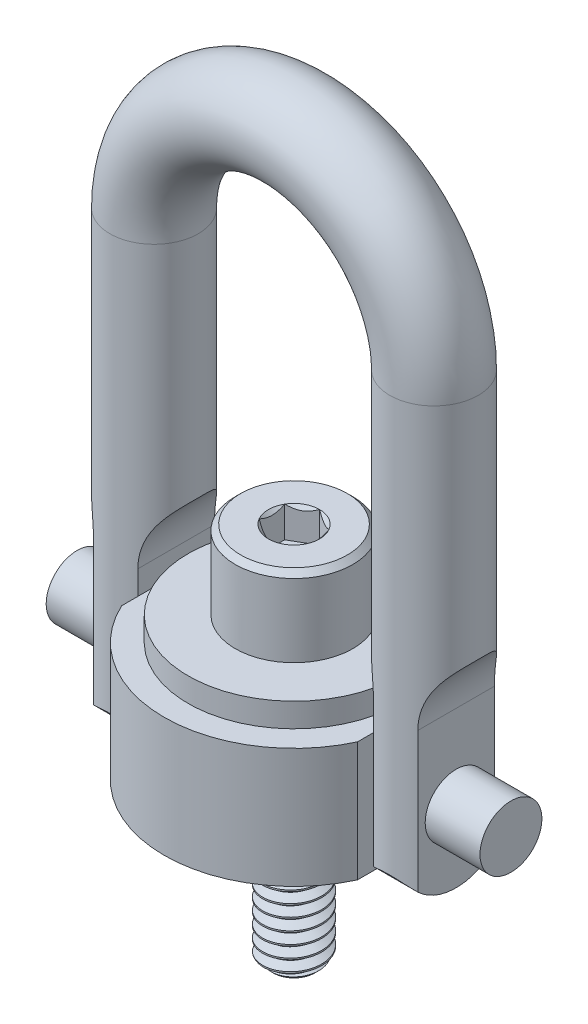
from build123d import *

# Parameters (mm, degrees)
SKETCH5_R               = 4.7625
CUT_EXTRUDE3_START      = -4.124446086
CUT_EXTRUDE3_DEPTH      = 8.248892072
CUT_EXTRUDE5_START      = 2.576285714
CUT_EXTRUDE5_DEPTH      = 12.881428572
CUT_EXTRUDE4_DEPTH      = 73.451442211
CUT_EXTRUDE4_DEPTH_BACK = 73.451442211
SKETCH8_R               = 2.524125
CHAMFER2_SIZE           = 0.9525
CUT_SWEEP1_PITCH        = 1.27
CUT_EXTRUDE1_DEPTH      = 3.33375
CHAMFER1_SIZE           = 0.591185
SKETCH15_R              = 3.175
CUT_EXTRUDE6_DEPTH      = 58.136973904


# Read off the part's stored shape, not the designer's step: Cut-Extrude3, Cut-Extrude5
with BuildPart() as part:
    # Sketch1 → Revolve1 (revolve)
    with BuildSketch(Plane.XY, mode=Mode.PRIVATE) as revolve1_sk:
        Polygon((-11.411857143, 18.034), (-11.411857143, 15.457714286), (-13.988142857, 15.457714286), (-13.988142857, 2.576285714), (-8.835571429, 2.576285714), (-8.835571429, 0), (-3.175, 0), (-3.175, 18.034), align=None)
    revolve(revolve1_sk.sketch.rotate(Axis((0, 0, 0), (0, 1, 0)), 270), axis=Axis((0, 0, 0), (0, 1, 0)))

    # Cut-Extrude5 outline → Cut-Extrude5 (cut)
    with BuildSketch(Plane(origin=(0, 0, 0), x_dir=(1, 0, 0), z_dir=(0, 1, 0)).offset(CUT_EXTRUDE5_START)):
        with BuildLine():
            Line((12.7, 5.863287524), (12.7, -5.863287524))
            ThreePointArc((12.7, -5.863287524), (13.988142857, 0), (12.7, 5.863287524))
        make_face()
        with BuildLine():
            ThreePointArc((-12.7, 5.863287524), (-13.988142857, 0), (-12.7, -5.863287524))
            Line((-12.7, -5.863287524), (-12.7, 5.863287524))
        make_face()
    extrude(amount=CUT_EXTRUDE5_DEPTH, mode=Mode.SUBTRACT)

    # Sketch9 → Revolve3 (revolve)
    with BuildSketch(Plane.XY, mode=Mode.PRIVATE) as revolve3_sk:
        Polygon((-17.4625, 11.541125), (17.4625, 11.541125), (17.4625, 12.35075), (23.368, 12.35075), (23.368, 9.017), (-23.368, 9.017), (-23.368, 12.35075), (-17.4625, 12.35075), align=None)
    revolve(revolve3_sk.sketch.rotate(Axis((-23.368, 9.017, 0), (1, 0, 0)), 90), axis=Axis((-23.368, 9.017, 0), (1, 0, 0)))

    # Sketch15 → Cut-Extrude6 (cut, through all)
    with BuildSketch(Plane(origin=(0, 18.034, 0), x_dir=(1, 0, 0), z_dir=(0, 1, 0))):
        Circle(SKETCH15_R)
    extrude(amount=-CUT_EXTRUDE6_DEPTH, mode=Mode.SUBTRACT)


with BuildPart() as body_2:
    # Sweep1: sweep along a path in Sketch6
    with BuildLine(Plane.XY) as sweep1_path:
        Line((-10.31875, 0), (-10.31875, 48.41875))
        ThreePointArc((-10.31875, 48.41875), (0, 58.7375), (10.31875, 48.41875))
        Line((10.31875, 48.41875), (10.31875, 0))
    # Sketch5 → Sweep1 (sweep)
    with BuildSketch(Plane(origin=(0, 0, 0), x_dir=(1, 0, 0), z_dir=(0, 1, 0))):
        with Locations((-15.08125, 0)):
            Circle(SKETCH5_R)
    sweep(path=sweep1_path.line)

    # Cut-Extrude3 outline → Cut-Extrude3 (cut)
    with BuildSketch(Plane.XY.offset(CUT_EXTRUDE3_START)):
        with BuildLine():
            Line((-17.4625, 0), (-17.4625, 18.034))
            ThreePointArc((-17.4625, 18.034), (-18.081454591, 21.145465211), (-19.844074757, 23.783170784))
            Line((-19.844074757, 23.783170784), (-21, 24.93896544))
            Line((-21, 24.93896544), (-21, 0))
            Line((-21, 0), (-17.4625, 0))
        make_face()
        with BuildLine():
            Line((-12.7, 18.034), (-12.7, 0))
            Line((-12.7, 0), (-9, 0))
            Line((-9, 0), (-9, 25))
            Line((-9, 25), (-9.101458544, 25))
            Line((-9.101458544, 25), (-10.318425243, 23.783170784))
            ThreePointArc((-10.318425243, 23.783170784), (-12.081045409, 21.145465211), (-12.7, 18.034))
        make_face()
    cut_extrude3 = extrude(amount=CUT_EXTRUDE3_DEPTH, mode=Mode.SUBTRACT)

    # Mirror1: Cut-Extrude3 across plane
    add(cut_extrude3.mirror(Plane(origin=(0, 0, 0), x_dir=(0, 0, 1), z_dir=(1, 0, 0))), mode=Mode.SUBTRACT)

    # Sketch8 → Cut-Extrude4 (cut, two sides: drawn at the far end of the back side and taken through both)
    with BuildSketch(Plane(origin=(0, 0, 0), x_dir=(0, 0, -1), z_dir=(1, 0, 0)).offset(-CUT_EXTRUDE4_DEPTH_BACK)):
        with Locations((0, 9.017)):
            Circle(SKETCH8_R)
        with BuildLine():
            Line((4.7625, 3.669392857), (4.7625, 0))
            Line((4.7625, 0), (-4.7625, 0))
            Line((-4.7625, 0), (-4.7625, 3.669392857))
            ThreePointArc((-4.7625, 3.669392857), (0, 1.288142857), (4.7625, 3.669392857))
        make_face()
    extrude(amount=CUT_EXTRUDE4_DEPTH + CUT_EXTRUDE4_DEPTH_BACK, mode=Mode.SUBTRACT)


with BuildPart() as body_3:
    # Sketch2 → Revolve2 (revolve)
    with BuildSketch(Plane.XY):
        Polygon((6.334125, 26.4795), (0, 26.4795), (0, -14.2875), (3.175, -14.2875), (3.175, 18.034), (6.334125, 18.034), align=None)
    revolve(axis=Axis((0, -14.2875, 0), (0, 1, 0)))

    # Chamfer2
    chamfer2_edges = [body_3.edges().sort_by_distance(p)[0] for p in [
        (-3.175, -14.2875, 0),
    ]]
    chamfer(chamfer2_edges, length=CHAMFER2_SIZE)

    # Cut-Sweep1: the profile of Sketch11 profile screwed along a right-hand helix of 24.45 turns, 8 arcs to a turn; built about Z, then put on its axis
    cut_sweep1_z = Axis((0, 0, 0), (0, 0, 1))
    cut_sweep1_corners = [(3.1753, 0, 0.000173205), (3.1753, 0, -1.111423205), (2.350110803, 0, -0.635), (2.350110803, 0, -0.47625)]
    with BuildLine(mode=Mode.PRIVATE) as cut_sweep1_profile:
        Line(cut_sweep1_corners[0], cut_sweep1_corners[1])
        Line(cut_sweep1_corners[1], cut_sweep1_corners[2])
        Line(cut_sweep1_corners[2], cut_sweep1_corners[3])
        Line(cut_sweep1_corners[3], cut_sweep1_corners[0])
    cut_sweep1_cap = Face(cut_sweep1_profile.wire())
    cut_sweep1_turn_angles = [0, 22.5, 45, 67.5, 90, 112.5, 135, 157.5, 180, 202.5, 225, 247.5, 270, 292.5, 315, 337.5, 360]
    cut_sweep1_turn_weights = [1, 0.9238795325112867, 1, 0.9238795325112867, 1, 0.9238795325112867, 1, 0.9238795325112867, 1, 0.9238795325112867, 1, 0.9238795325112867, 1, 0.9238795325112867, 1, 0.9238795325112867, 1]
    cut_sweep1_turn_rails = [Edge.make_bspline([Vector(p[0], p[1], 0).rotate(cut_sweep1_z, cut_sweep1_turn_angles[k]) / cut_sweep1_turn_weights[k] + Vector(0, 0, p[2] + CUT_SWEEP1_PITCH * cut_sweep1_turn_angles[k] / 360) for k in range(17)], [0, 0, 0, 1, 1, 2, 2, 3, 3, 4, 4, 5, 5, 6, 6, 7, 7, 8, 8, 8], 2, cut_sweep1_turn_weights) for p in cut_sweep1_corners]
    cut_sweep1_turn_sides = [Face.make_surface_from_curves(cut_sweep1_turn_rails[p[0]], cut_sweep1_turn_rails[p[1]]) for p in [(0, 1), (1, 2), (2, 3), (3, 0)]]
    cut_sweep1_last_angles = [8640, 8662.5, 8685, 8707.5, 8730, 8752.5, 8775, 8788.5, 8802]
    cut_sweep1_last_weights = [1, 0.9238795325112867, 1, 0.9238795325112867, 1, 0.9238795325112867, 1, 0.972369920397873, 1]
    cut_sweep1_last_rails = [Edge.make_bspline([Vector(p[0], p[1], 0).rotate(cut_sweep1_z, cut_sweep1_last_angles[k]) / cut_sweep1_last_weights[k] + Vector(0, 0, p[2] + CUT_SWEEP1_PITCH * cut_sweep1_last_angles[k] / 360) for k in range(9)], [0, 0, 0, 1, 1, 2, 2, 3, 3, 4, 4, 4], 2, cut_sweep1_last_weights) for p in cut_sweep1_corners]
    cut_sweep1_last_sides = [Face.make_surface_from_curves(cut_sweep1_last_rails[p[0]], cut_sweep1_last_rails[p[1]]) for p in [(0, 1), (1, 2), (2, 3), (3, 0)]]
    cut_sweep1 = Plane(origin=(0, -14.2875, 0), x_dir=(1, 0, 0), z_dir=(0, 1, 0)) * Solid(Shell([*[p.moved(Location((0, 0, CUT_SWEEP1_PITCH * i))) for i in range(24) for p in cut_sweep1_turn_sides], *cut_sweep1_last_sides, cut_sweep1_cap, cut_sweep1_cap.rotate(cut_sweep1_z, 8802).moved(Location((0, 0, CUT_SWEEP1_PITCH * 8802 / 360)))]))
    add(cut_sweep1, mode=Mode.SUBTRACT)

    # Sketch3 → Cut-Extrude1 (cut)
    with BuildSketch(Plane(origin=(0, 26.4795, 0), x_dir=(1, 0, 0), z_dir=(0, 1, 0))):
        Polygon((2.38125, -1.374815329), (2.38125, 1.374815329), (0, 2.749630657), (-2.38125, 1.374815329), (-2.38125, -1.374815329), (0, -2.749630657), align=None)
    extrude(amount=-CUT_EXTRUDE1_DEPTH, mode=Mode.SUBTRACT)

    # Cut-Extrude2 cone 1 section (through the dimple's axis) → Cut-Extrude2 (revolve, cut)
    with BuildSketch(Plane(origin=(0, 26.4795, 0), x_dir=(0, 0, 1), z_dir=(1, 0, 0))):
        Polygon((0, 0), (2.749630657, 0), (0, 2.749630657), align=None)
    revolve(axis=Axis((0, 26.4795, 0), (0, -1, 0)), mode=Mode.SUBTRACT)

    # Chamfer1
    chamfer1_edges = [body_3.edges().sort_by_distance(p)[0] for p in [
        (-6.334125, 26.4795, 0),
    ]]
    chamfer(chamfer1_edges, length=CHAMFER1_SIZE)


solid = Compound([part.part, body_2.part, body_3.part])
